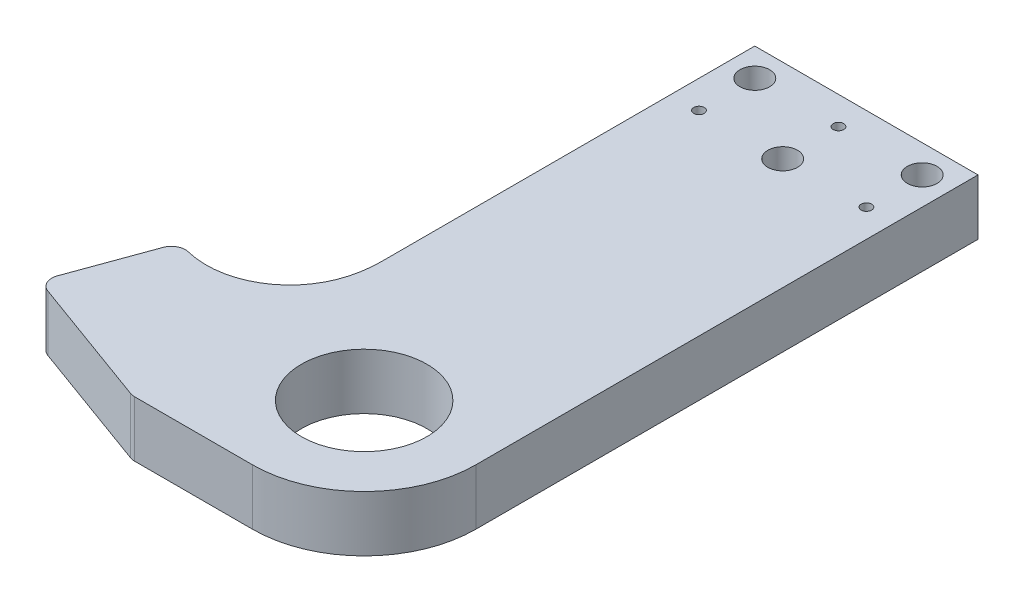
from build123d import *

# Parameters (mm, degrees)
BOSS_EXTRUDE1_DEPTH              = 6.35
FILLET1_R                        = 25.4
SKETCH11_R                       = 14.2875
CUT_EXTRUDE1_DEPTH               = 88.298066989
F_1_4_CLEARANCE_HOLE1_D          = 6.7564
BOSS_EXTRUDE2_DEPTH              = 12.7
FILLET2_R                        = 25
SKETCH25_W                       = 25
SKETCH25_H                       = 12.7
BOSS_EXTRUDE3_DEPTH              = 12
TAP_DRILL_FOR_10_32_TAP1_D       = 4.0386
TAP_DRILL_FOR_10_32_TAP1_DEPTH   = 25.4
TAP_DRILL_FOR_10_32_TAP1_TIP     = 1.213317848
FILLET4_R                        = 19.05
BOSS_EXTRUDE4_DEPTH              = 12.7
FILLET3_R                        = 3.175
F_3_32_0_09375_DOWEL_HOLE2_D     = 2.38125
F_3_32_0_09375_DOWEL_HOLE2_DEPTH = 8.128
F_3_32_0_09375_DOWEL_HOLE2_TIP   = 0.715399675


with BuildPart() as part:
    # Sketch2 → Boss-Extrude1 (new, symmetric)
    with BuildSketch(Plane(origin=(0, 0, 0), x_dir=(1, 0, 0), z_dir=(0, 1, 0))):
        Polygon((25.4, -82.55), (25.4, 0), (25.4, 57.15), (-25.4, 57.15), (-25.4, 0), (-25.4, -82.55), align=None)
    extrude(amount=BOSS_EXTRUDE1_DEPTH, both=True)

    # Fillet1
    fillet1_edges = [part.edges().sort_by_distance(p)[0] for p in [
        (25.4, 0, 82.55),
        (-25.4, 0, 82.55),
    ]]
    fillet(fillet1_edges, radius=FILLET1_R - 0.0001)  # a hair under: the kernel refuses the full size

    # Sketch11 → Cut-Extrude1 (cut, through all)
    with BuildSketch(Plane(origin=(0, 6.35, 0), x_dir=(1, 0, 0), z_dir=(0, 1, 0))):
        with Locations(Location((0, -57.15, 0), (0, 0, 270))):
            Circle(SKETCH11_R)
    extrude(amount=-CUT_EXTRUDE1_DEPTH, mode=Mode.SUBTRACT)

    # 1/4 Clearance Hole1 (through all)
    with Locations(Plane(origin=(0, 6.35, 0), x_dir=(1, 0, 0), z_dir=(0, 1, 0))):
        with Locations((-19.05, 50.8), (19.05, 50.8), (0, 38.1)):
            Hole(F_1_4_CLEARANCE_HOLE1_D / 2)

    # Sketch15 → Boss-Extrude2 (add)
    with BuildSketch(Plane.XZ.offset(6.35)):
        with BuildLine():
            Line((-4.225282002, 82.196097341), (-49.275251792, 74.59615776))
            Line((-49.275251792, 74.59615776), (-40.724748208, 51.10384224))
            Line((-40.724748208, 51.10384224), (-25.4, 42.256094737))
            Line((-25.4, 42.256094737), (-25.4, 57.15))
            ThreePointArc((-25.4, 57.15), (-19.396934846, 73.54874747), (-4.225282002, 82.196097341))
        make_face()
    extrude(amount=-BOSS_EXTRUDE2_DEPTH)

    # Fillet2
    fillet2_edges = [part.edges().sort_by_distance(p)[0] for p in [
        (-25.4, 0, 42.256094737),
    ]]
    fillet(fillet2_edges, radius=FILLET2_R)

    # Sketch25 → Boss-Extrude3 (add)
    with BuildSketch(Plane(origin=(-19.536399336, 0, -7.110667843), x_dir=(-0.34202014332566627, 0, 0.9396926207859093), z_dir=(-0.9396926207859093, 0, -0.34202014332566627))):
        with Locations((74.450587666, 0)):
            Rectangle(SKETCH25_W, SKETCH25_H)
    extrude(amount=BOSS_EXTRUDE3_DEPTH)

    # Tap Drill for #10-32 Tap1
    with Locations(Plane(origin=(-30.812710785, 0, -11.214909563), x_dir=(-0.3420201433256665, 0, 0.9396926207859093), z_dir=(-0.9396926207859092, 0, -0.34202014332566644))):
        with Locations((74.450587666, 0)):
            Hole(TAP_DRILL_FOR_10_32_TAP1_D / 2, depth=TAP_DRILL_FOR_10_32_TAP1_DEPTH)
            with Locations((0, 0, -(TAP_DRILL_FOR_10_32_TAP1_DEPTH + TAP_DRILL_FOR_10_32_TAP1_TIP / 2))):  # 118° drill point
                Cone(0, TAP_DRILL_FOR_10_32_TAP1_D / 2, TAP_DRILL_FOR_10_32_TAP1_TIP, mode=Mode.SUBTRACT)

    # Fillet4
    fillet4_edges = [part.edges().sort_by_distance(p)[0] for p in [
        (-40.724748208, 0, 51.10384224),
    ]]
    fillet(fillet4_edges, radius=FILLET4_R)

    # Sketch26 → Boss-Extrude4 (add)
    with BuildSketch(Plane.XZ.offset(6.35)):
        Polygon((-27.422249839, 82.55), (0, 82.55), (-49.275251792, 74.59615776), align=None)
    extrude(amount=-BOSS_EXTRUDE4_DEPTH)

    # Fillet3
    fillet3_edges = [part.edges().sort_by_distance(p)[0] for p in [
        (-60.551563241, 0, 70.49191604),
        (-52.001059658, 0, 46.99960052),
        (-27.422249839, 0, 82.55),
    ]]
    fillet(fillet3_edges, radius=FILLET3_R)

    # 3/32 (0.09375) Dowel Hole2
    with Locations(Plane(origin=(0, 6.35, 0), x_dir=(1, 0, 0), z_dir=(0, 1, 0))):
        with Locations((19.05, 38.1), (0, 50.8), (-19.05, 38.1), (0, 38.1)):
            Hole(F_3_32_0_09375_DOWEL_HOLE2_D / 2, depth=F_3_32_0_09375_DOWEL_HOLE2_DEPTH)
            with Locations((0, 0, -(F_3_32_0_09375_DOWEL_HOLE2_DEPTH + F_3_32_0_09375_DOWEL_HOLE2_TIP / 2))):  # 118° drill point
                Cone(0, F_3_32_0_09375_DOWEL_HOLE2_D / 2, F_3_32_0_09375_DOWEL_HOLE2_TIP, mode=Mode.SUBTRACT)


solid = part.part
